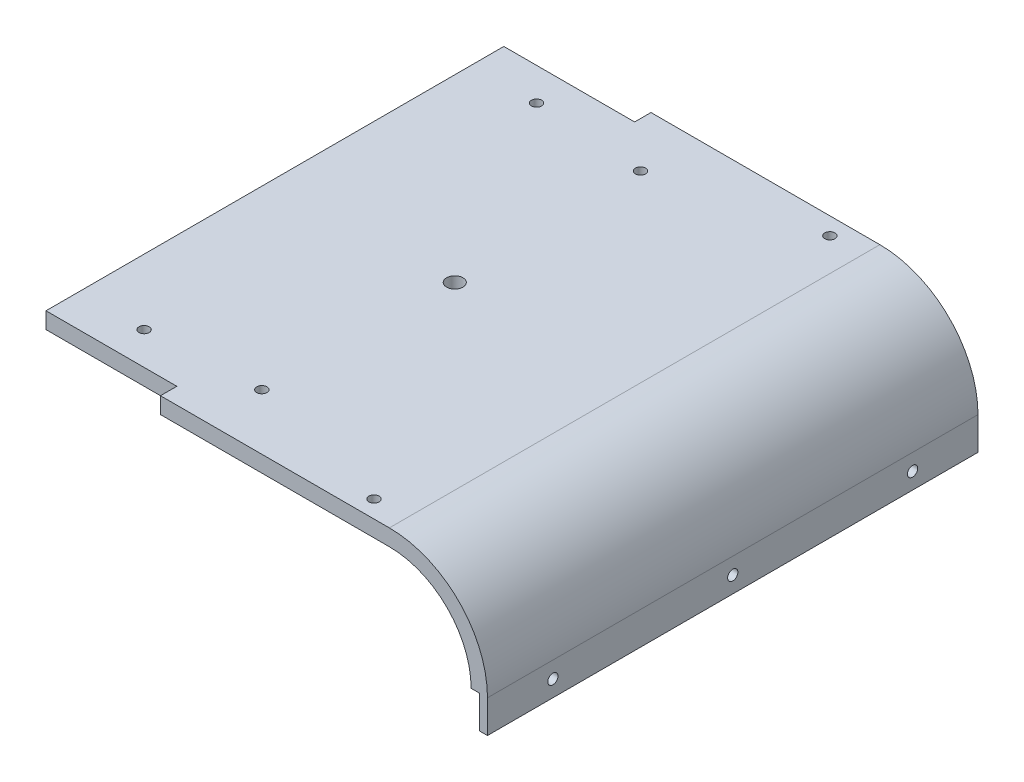
from build123d import *

# Parameters (mm, degrees)
BOSS_EXTRUDE1_DEPTH      = 190.5
BOSS_EXTRUDE1_DEPTH_BACK = 190.5
SKETCH2_W                = 6.35
SKETCH2_H                = 381
BOSS_EXTRUDE2_DEPTH      = 25.4
SKETCH3_R                = 3.96875
CUT_EXTRUDE1_DEPTH       = 25.4
SKETCH4_R                = 6.35
CUT_EXTRUDE2_DEPTH       = 17.78
SKETCH5_R                = 3.937
CUT_EXTRUDE3_DEPTH       = 306.328708116


with BuildPart() as part:
    # Sketch1 → Boss-Extrude1 (new, two sides: drawn at the far end of the back side and taken through both)
    with BuildSketch(Plane.XY.offset(-BOSS_EXTRUDE1_DEPTH_BACK)):
        with BuildLine():
            Line((-139.7, 0), (139.7, 0))
            ThreePointArc((139.7, 0), (193.581536726, -22.318463274), (215.9, -76.2))
            Line((215.9, -76.2), (203.2, -76.2))
            ThreePointArc((203.2, -76.2), (184.601280605, -31.298719395), (139.7, -12.7))
            Line((139.7, -12.7), (-139.7, -12.7))
            Line((-139.7, -12.7), (-139.7, 0))
        make_face()
    extrude(amount=BOSS_EXTRUDE1_DEPTH + BOSS_EXTRUDE1_DEPTH_BACK)

    # Sketch2 → Boss-Extrude2 (add)
    with BuildSketch(Plane.XZ.offset(76.2)):
        with Locations((212.725, 0)):
            Rectangle(SKETCH2_W, SKETCH2_H)
    extrude(amount=BOSS_EXTRUDE2_DEPTH)

    # Sketch3 → Cut-Extrude1 (cut)
    with BuildSketch(Plane(origin=(215.9, 0, 0), x_dir=(0, 0, -1), z_dir=(1, 0, 0))):
        with Locations((-139.7, -88.9)):
            Circle(SKETCH3_R)
        with Locations((0, -88.9)):
            Circle(SKETCH3_R)
        with Locations((139.7, -88.9)):
            Circle(SKETCH3_R)
    extrude(amount=-CUT_EXTRUDE1_DEPTH, mode=Mode.SUBTRACT)

    # Sketch4 → Cut-Extrude2 (cut)
    with BuildSketch(Plane(origin=(0, 0, 0), x_dir=(1, 0, 0), z_dir=(0, 1, 0))):
        Circle(SKETCH4_R)
    extrude(amount=-CUT_EXTRUDE2_DEPTH, mode=Mode.SUBTRACT)

    # Sketch5 → Cut-Extrude3 (cut, through all)
    with BuildSketch(Plane(origin=(0, 0, 0), x_dir=(1, 0, 0), z_dir=(0, 1, 0))):
        with Locations((114.3, -177.038)):
            Circle(SKETCH5_R)
        with Locations((114.3, 177.038)):
            Circle(SKETCH5_R)
        with Locations((-2.794, -147.066)):
            Circle(SKETCH5_R)
        with Locations((-2.794, 147.066)):
            Circle(SKETCH5_R)
        with Locations((-88.9, -152.4)):
            Circle(SKETCH5_R)
        with Locations((-88.9, 152.4)):
            Circle(SKETCH5_R)
        Polygon((-114.3, -177.8), (-139.7, -177.8), (-139.7, -190.5), (-38.1, -190.5), (-38.1, -177.8), align=None)
        Polygon((-38.1, 190.5), (-38.1, 177.8), (-114.3, 177.8), (-139.7, 177.8), (-139.7, 190.5), align=None)
    extrude(amount=-CUT_EXTRUDE3_DEPTH, mode=Mode.SUBTRACT)


solid = part.part
